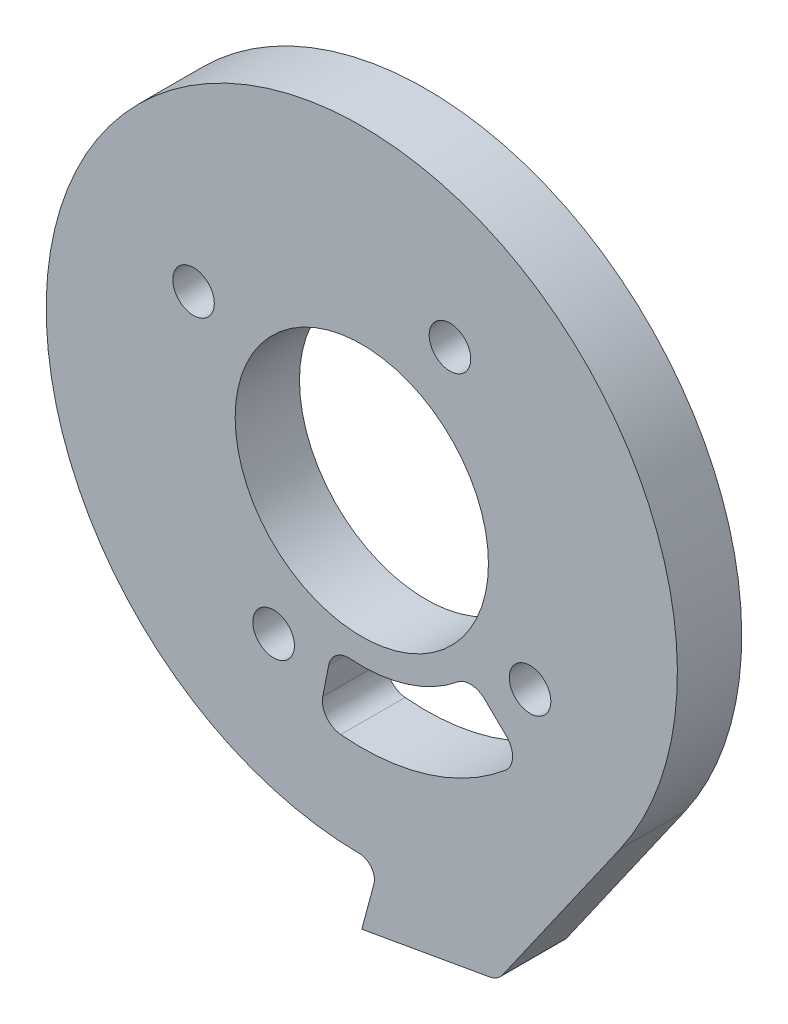
from build123d import *
from OCP.BRepFilletAPI import BRepFilletAPI_MakeFillet

# Parameters (mm, degrees)
SKETCH1_R                    = 25
BOSS_EXTRUDE1_DEPTH          = 12.7
FILLET1_R1                   = 4
FILLET1_R2                   = 3
CUT_EXTRUDE1_DEPTH           = 99.32385265
FILLET2_R                    = 4
F_5_16_CLEARANCE_HOLE1_D     = 8.2042
F_5_16_CLEARANCE_HOLE1_DEPTH = 54.11
F_5_16_CLEARANCE_HOLE1_TIP   = 2.464790345


with BuildPart() as part:
    # Sketch1 → Boss-Extrude1 (new body)
    with BuildSketch(Plane.XY):
        with BuildLine():
            Line((3.428248194, -62.20560356), (0, -75))
            Line((0, -75), (26.854266439, -70.26486828))
            Line((26.854266439, -70.26486828), (51.033172359, -35.733811985))
            ThreePointArc((51.033172359, -35.733811985), (-30.277062596, 54.448043863), (3.428248194, -62.20560356))
        make_face()
        Circle(SKETCH1_R, mode=Mode.SUBTRACT)
    extrude(amount=BOSS_EXTRUDE1_DEPTH)

    # Fillet1: one fillet with a radius per group of edges: ONE call of the kernel's fillet builder (fillet() takes one radius for all edges)
    fillet1_edges_1 = [part.edges().sort_by_distance(p)[0] for p in [
        (26.854266439, -70.26486828, 6.35),
    ]]
    fillet1_edges_2 = [part.edges().sort_by_distance(p)[0] for p in [
        (3.428248194, -62.20560356, 6.35),
    ]]
    fillet1 = BRepFilletAPI_MakeFillet(part.part.solid().wrapped)
    for e in fillet1_edges_1:
        fillet1.Add(FILLET1_R1, e.wrapped)
    for e in fillet1_edges_2:
        fillet1.Add(FILLET1_R2, e.wrapped)
    add(Compound.cast(fillet1.Shape()), mode=Mode.REPLACE)

    # Sketch2 → Cut-Extrude1 (cut, through all)
    with BuildSketch(Plane.XY.offset(12.7)):
        with BuildLine():
            Line((31.566860071, -30.651808189), (21.52285914, -20.898960129))
            ThreePointArc((21.52285914, -20.898960129), (8.94253502, -28.636184582), (-5.805153528, -29.432977976))
            Line((-5.805153528, -29.432977976), (-8.514225174, -43.168367698))
            ThreePointArc((-8.514225174, -43.168367698), (13.115718029, -41.999737387), (31.566860071, -30.651808189))
        make_face()
    extrude(amount=-CUT_EXTRUDE1_DEPTH, mode=Mode.SUBTRACT)

    # Fillet2
    fillet2_edges = [part.edges().sort_by_distance(p)[0] for p in [
        (-5.805153528, -29.432977976, 6.35),
        (31.566860071, -30.651808189, 6.35),
        (-8.514225174, -43.168367698, 6.35),
        (21.52285914, -20.898960129, 6.35),
    ]]
    fillet(fillet2_edges, radius=FILLET2_R)

    # 5/16 Clearance Hole1
    with Locations(Plane.XY.offset(12.7)):
        with Locations((-33.215209323, 17.40689144), (17.40689144, 33.215209323), (-17.40689144, -33.215209323), (33.215209323, -17.40689144)):
            Hole(F_5_16_CLEARANCE_HOLE1_D / 2, depth=F_5_16_CLEARANCE_HOLE1_DEPTH)
            with Locations((0, 0, -(F_5_16_CLEARANCE_HOLE1_DEPTH + F_5_16_CLEARANCE_HOLE1_TIP / 2))):  # 118° drill point
                Cone(0, F_5_16_CLEARANCE_HOLE1_D / 2, F_5_16_CLEARANCE_HOLE1_TIP, mode=Mode.SUBTRACT)


solid = part.part
